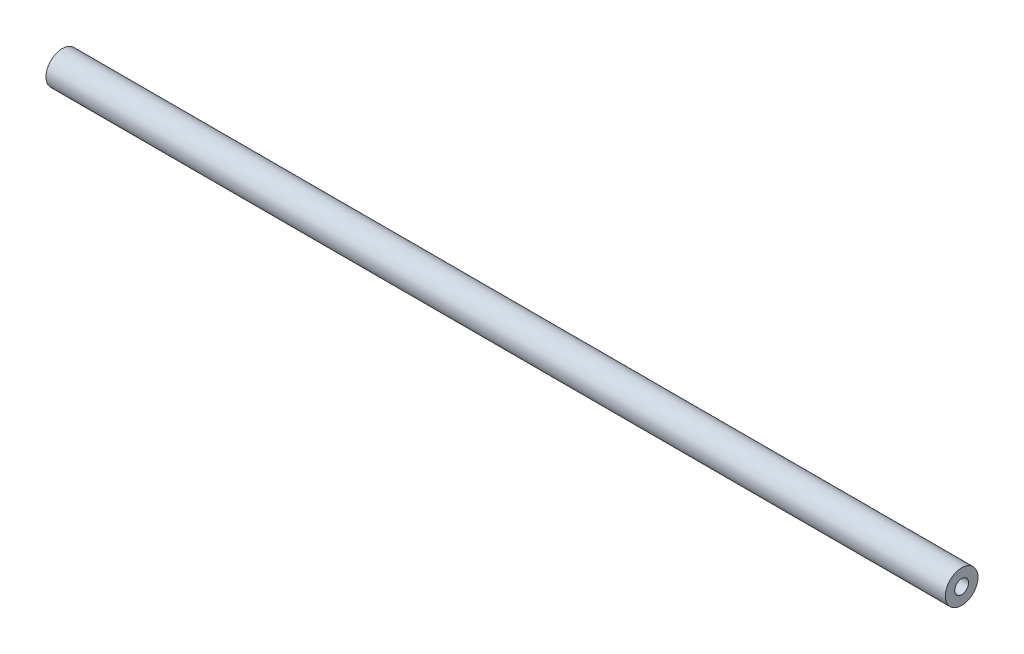
from build123d import *

# Parameters (mm, degrees)
SKETCH1_R                            = 4.7625
BOSS_EXTRUDE1_DEPTH                  = 130.96875
F_10_32_TAPPED_HOLE1_D               = 4.0386
F_10_32_TAPPED_HOLE1_DEPTH           = 12.02944
F_10_32_TAPPED_HOLE1_TIP             = 1.213317848
F_10_32_TAPPED_HOLE1_ON_FACE_2_D     = 4.0386
F_10_32_TAPPED_HOLE1_ON_FACE_2_DEPTH = 12.02944
F_10_32_TAPPED_HOLE1_ON_FACE_2_TIP   = 1.213317848


with BuildPart() as part:
    # Sketch1 → Boss-Extrude1 (new, symmetric)
    with BuildSketch(Plane(origin=(0, 0, 0), x_dir=(0, 0, -1), z_dir=(1, 0, 0))):
        Circle(SKETCH1_R)
    extrude(amount=BOSS_EXTRUDE1_DEPTH, both=True)

    # #10-32 Tapped Hole1
    with Locations(Plane(origin=(130.96875, 0, 0), x_dir=(0, 0, 1), z_dir=(1, 0, 0))):
        with Locations((0, 0)):
            Hole(F_10_32_TAPPED_HOLE1_D / 2, depth=F_10_32_TAPPED_HOLE1_DEPTH)
            with Locations((0, 0, -(F_10_32_TAPPED_HOLE1_DEPTH + F_10_32_TAPPED_HOLE1_TIP / 2))):  # 118° drill point
                Cone(0, F_10_32_TAPPED_HOLE1_D / 2, F_10_32_TAPPED_HOLE1_TIP, mode=Mode.SUBTRACT)

    # #10-32 Tapped Hole1 on face 2
    with Locations(Plane(origin=(-130.96875, 0, 0), x_dir=(0, 0, -1), z_dir=(-1, 0, 0))):
        with Locations((0, 0)):
            Hole(F_10_32_TAPPED_HOLE1_ON_FACE_2_D / 2, depth=F_10_32_TAPPED_HOLE1_ON_FACE_2_DEPTH)
            with Locations((0, 0, -(F_10_32_TAPPED_HOLE1_ON_FACE_2_DEPTH + F_10_32_TAPPED_HOLE1_ON_FACE_2_TIP / 2))):  # 118° drill point
                Cone(0, F_10_32_TAPPED_HOLE1_ON_FACE_2_D / 2, F_10_32_TAPPED_HOLE1_ON_FACE_2_TIP, mode=Mode.SUBTRACT)


solid = part.part
